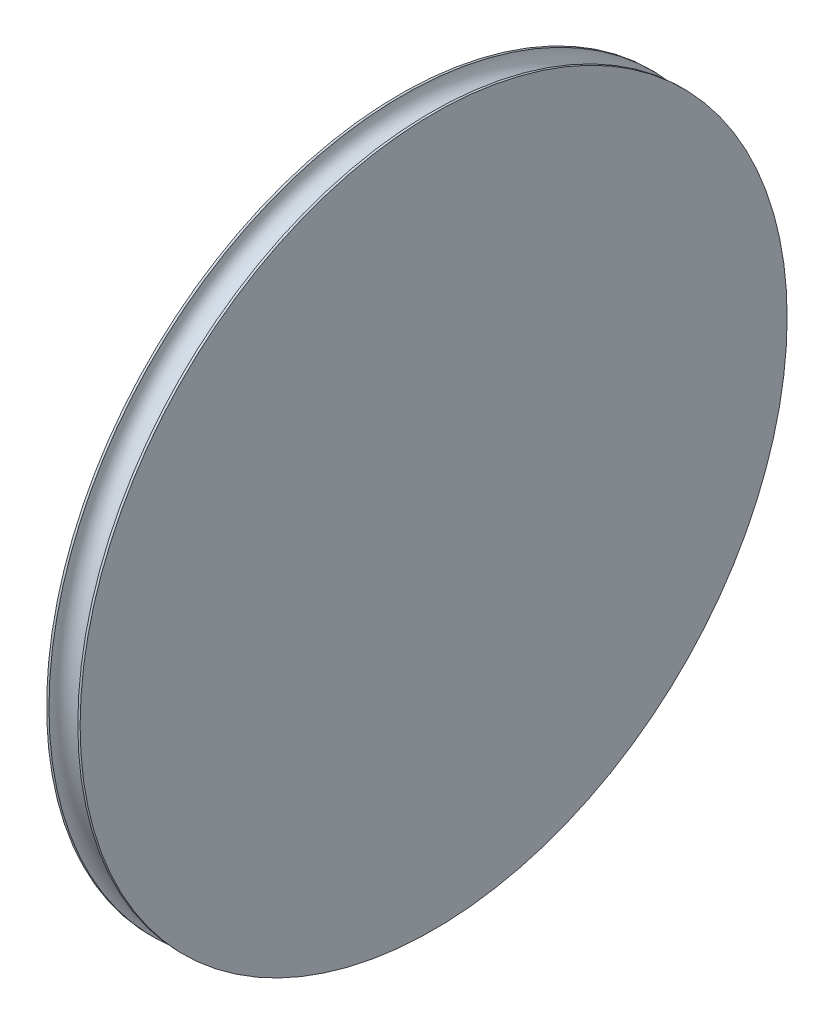
from build123d import *

# Parameters (mm, degrees)
SKETCH1_R           = 38.89375
BOSS_EXTRUDE1_DEPTH = 3.683
SKETCH10_R          = 1.5875


with BuildPart() as part:
    # Sketch1 → Boss-Extrude1 (new body)
    with BuildSketch(Plane(origin=(0, 0, 0), x_dir=(0, 0, -1), z_dir=(1, 0, 0))):
        Circle(SKETCH1_R)
    extrude(amount=BOSS_EXTRUDE1_DEPTH)

    # Sketch10 → Cut-Revolve1 (revolve, cut)
    with BuildSketch(Plane.XY):
        with Locations((1.8415, 38.89375)):
            Circle(SKETCH10_R)
    revolve(axis=Axis((-1.01619145, 0, 0), (1, 0, 0)), mode=Mode.SUBTRACT)


solid = part.part
